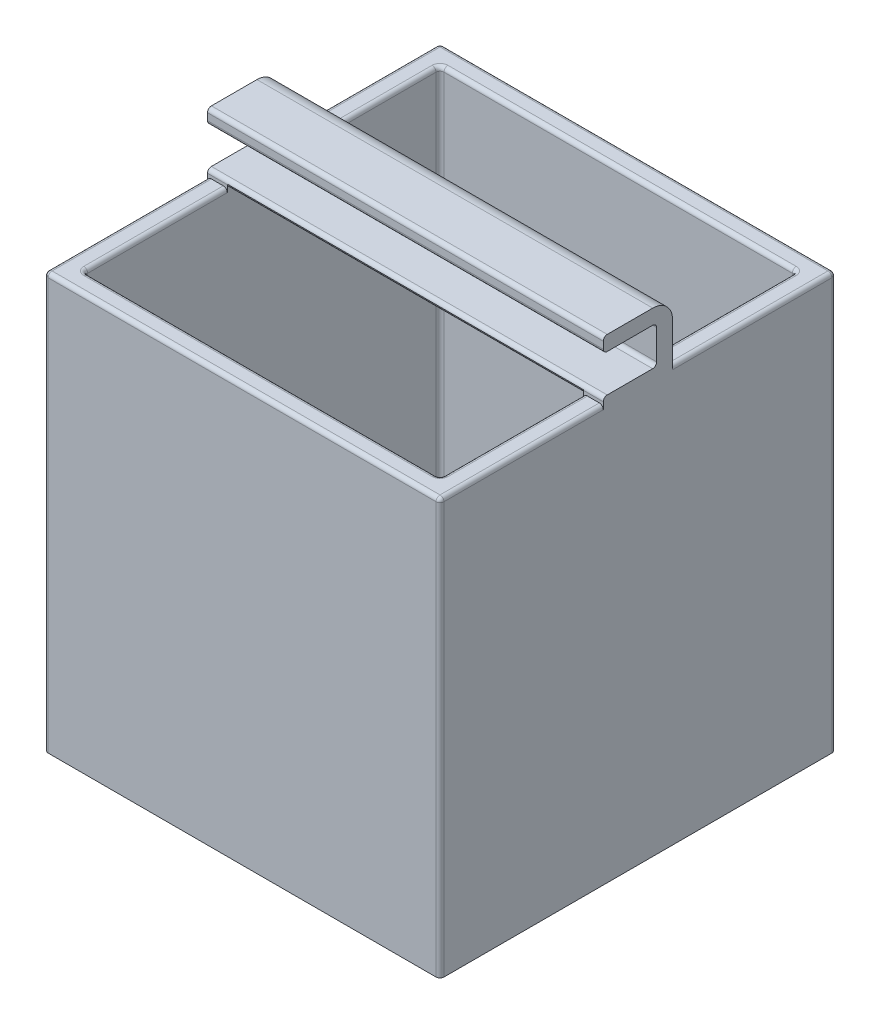
from build123d import *

# Parameters (mm, degrees)
SKETCH1_W               = 200
SKETCH1_H               = 200
SKETCH1_W_2             = 180
SKETCH1_H_2             = 180
BOSS_EXTRUDE1_DEPTH     = 200
SKETCH2_W               = 200
SKETCH2_H               = 200
BOSS_EXTRUDE2_DEPTH     = 10
SKETCH3_W               = 200
SKETCH3_H               = 35
BOSS_EXTRUDE3_DEPTH     = 30
CUT_EXTRUDE1_DEPTH      = 321.780298647
CUT_EXTRUDE1_DEPTH_BACK = 321.780298647
SKETCH4_W               = 26.954773083
SKETCH4_H               = 19
FILLET1_R               = 10
FILLET3_R               = 2
FILLET4_R               = 2
FILLET6_R               = 2
FILLET7_R               = 2
FILLET8_R               = 2
FILLET9_R               = 2


with BuildPart() as part:
    # Sketch1 → Boss-Extrude1 (new body)
    with BuildSketch(Plane(origin=(0, 0, 0), x_dir=(1, 0, 0), z_dir=(0, 1, 0))):
        Rectangle(SKETCH1_W, SKETCH1_H)
        Rectangle(SKETCH1_W_2, SKETCH1_H_2, mode=Mode.SUBTRACT)
    extrude(amount=BOSS_EXTRUDE1_DEPTH)

    # Sketch2 → Boss-Extrude2 (add)
    with BuildSketch(Plane.XZ):
        Rectangle(SKETCH2_W, SKETCH2_H)
    extrude(amount=BOSS_EXTRUDE2_DEPTH)

    # Sketch3 → Boss-Extrude3 (add)
    with BuildSketch(Plane(origin=(0, 200, 0), x_dir=(1, 0, 0), z_dir=(0, 1, 0))):
        Rectangle(SKETCH3_W, SKETCH3_H)
    extrude(amount=BOSS_EXTRUDE3_DEPTH)

    # Sketch4 → Cut-Extrude1 (cut, two sides: drawn at the far end of the back side and taken through both)
    with BuildSketch(Plane(origin=(100, 0, 0), x_dir=(0, 0, -1), z_dir=(1, 0, 0)).offset(-CUT_EXTRUDE1_DEPTH_BACK)):
        with Locations((-4.022613458, 212.997200487)):
            Rectangle(SKETCH4_W, SKETCH4_H)
    extrude(amount=CUT_EXTRUDE1_DEPTH + CUT_EXTRUDE1_DEPTH_BACK, mode=Mode.SUBTRACT)

    # Fillet1
    fillet1_edges = [part.edges().sort_by_distance(p)[0] for p in [
        (0, 230, -17.5),
    ]]
    fillet(fillet1_edges, radius=FILLET1_R)

    # Fillet3
    fillet3_edges = [part.edges().sort_by_distance(p)[0] for p in [
        (0, 200, -17.5),
    ]]
    fillet(fillet3_edges, radius=FILLET3_R)

    # Fillet4
    fillet4_edges = [part.edges().sort_by_distance(p)[0] for p in [
        (-100, 200, -58.75),
        (90, 0, 0),
        (90, 100, 90),
        (0, 0, -90),
        (90, 100, -90),
        (-90, 0, 0),
        (-90, 100, -90),
        (-90, 100, 90),
        (90, 200, 53.75),
        (0, 200, 100),
        (0, 200, -90),
        (-90, 200, -53.75),
        (0, 200, 90),
        (100, 200, -58.75),
        (-100, 200, 58.75),
        (90, 200, -53.75),
        (-90, 200, 53.75),
        (100, 200, 58.75),
        (100, 95, 100),
        (-100, 95, 100),
        (-100, 95, -100),
        (100, 95, -100),
        (0, 200, -100),
    ]]
    fillet(fillet4_edges, radius=FILLET4_R)

    # Fillet6
    fillet6_edges = [part.edges().sort_by_distance(p)[0] for p in [
        (0, 200, 17.5),
    ]]
    fillet(fillet6_edges, radius=FILLET6_R)

    # Fillet7
    fillet7_edges = [part.edges().sort_by_distance(p)[0] for p in [
        (0, 203.497200487, -9.454773083),
    ]]
    fillet(fillet7_edges, radius=FILLET7_R)

    # Fillet8
    fillet8_edges = [part.edges().sort_by_distance(p)[0] for p in [
        (0, 230, 17.5),
        (0, 222.497200487, -9.454773083),
        (0, 222.497200487, 17.5),
    ]]
    fillet(fillet8_edges, radius=FILLET8_R)

    # Fillet9
    # the kernel refuses this fillet: 2 mm, written as the material it takes off along each edge
    with BuildSketch(Plane(origin=(-105, 203.497200487, 17.5), x_dir=(0, 0, -1), z_dir=(1, 0, 0))) as fillet9_piece_1:
        with BuildLine():
            CenterArc((FILLET9_R, -FILLET9_R), FILLET9_R, 90, 90)
            Line((0, -FILLET9_R), (0, 0))
            Line((0, 0), (FILLET9_R, 0))
        make_face()
    extrude(amount=210, mode=Mode.SUBTRACT)


solid = part.part
